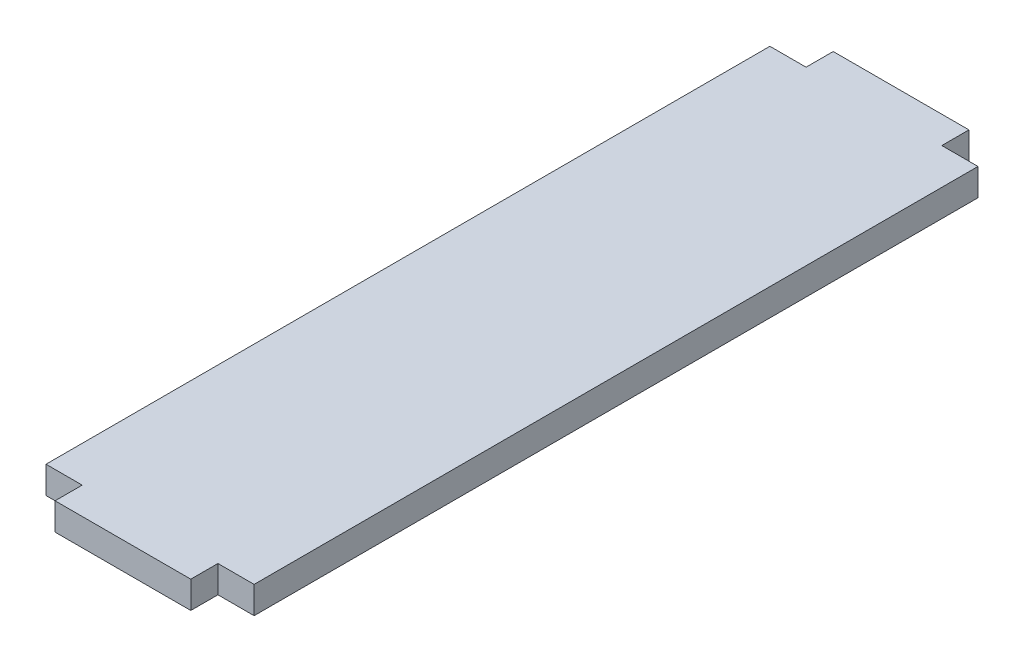
from build123d import *

# Parameters (mm, degrees)
BOSS_EXTRUDE1_DEPTH = 1.5


with BuildPart() as part:
    # Sketch1 → Boss-Extrude1 (new body)
    with BuildSketch(Plane(origin=(0, 0, 0), x_dir=(1, 0, 0), z_dir=(0, 1, 0))):
        Polygon((3.75, 20), (5.75, 20), (5.75, -20), (3.75, -20), (3.75, -21.5), (-3.75, -21.5), (-3.75, -20), (-5.75, -20), (-5.75, 20), (-3.75, 20), (-3.75, 21.5), (3.75, 21.5), align=None)
    extrude(amount=BOSS_EXTRUDE1_DEPTH)


solid = part.part
